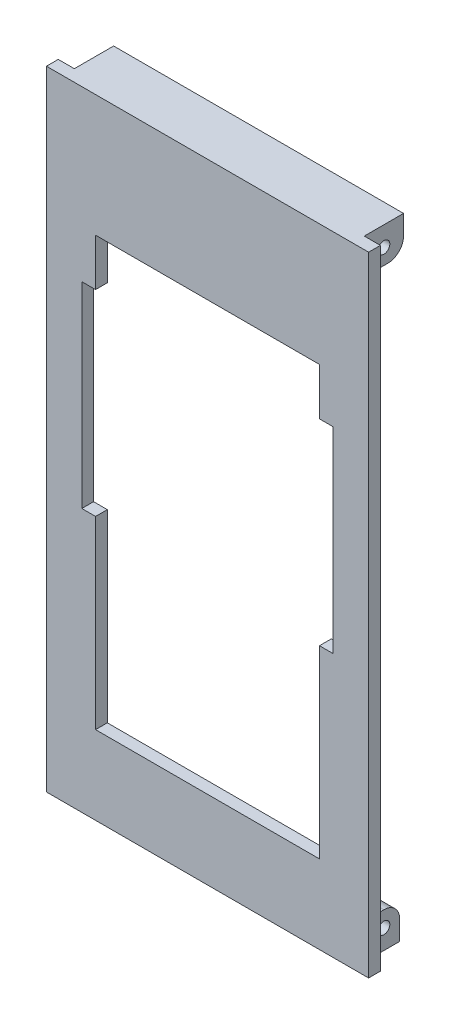
from build123d import *

# Parameters (mm, degrees)
SKETCH3_R           = 1.5
BOSS_EXTRUDE3_DEPTH = 82
CUT_EXTRUDE1_DEPTH  = 181.258148221
SKETCH5_W           = 4.1
SKETCH5_H           = 12
CUT_EXTRUDE2_DEPTH  = 181.258148221
FILLET1_R           = 4


with BuildPart() as part:
    # Sketch3 → Boss-Extrude3 (new body)
    with BuildSketch(Plane(origin=(0, 0, 0), x_dir=(0, 0, -1), z_dir=(1, 0, 0))):
        Polygon((0, 160), (13, 160), (13, 151), (3, 151), (3, 9), (12, 9), (12, 0), (0, 0), align=None)
        with Locations((8, 155)):
            Circle(SKETCH3_R, mode=Mode.SUBTRACT)
        with Locations((8, 5)):
            Circle(SKETCH3_R, mode=Mode.SUBTRACT)
    extrude(amount=BOSS_EXTRUDE3_DEPTH)

    # Sketch4 → Cut-Extrude1 (cut, through all)
    with BuildSketch(Plane.XY):
        Polygon((12.5, 117), (12.5, 129), (69.5, 129), (69.5, 117), (73, 117), (73, 67), (69.5, 67), (69.5, 20), (12.5, 20), (12.5, 67), (9, 67), (9, 117), align=None)
    extrude(amount=-CUT_EXTRUDE1_DEPTH, mode=Mode.SUBTRACT)

    # Sketch5 → Cut-Extrude2 (cut, through all)
    with BuildSketch(Plane(origin=(0, 0, 0), x_dir=(1, 0, 0), z_dir=(0, 1, 0))):
        with Locations((79.95, 9)):
            Rectangle(SKETCH5_W, SKETCH5_H)
        with Locations((2.05, 9)):
            Rectangle(SKETCH5_W, SKETCH5_H)
    extrude(amount=CUT_EXTRUDE2_DEPTH, mode=Mode.SUBTRACT)

    # Fillet1
    fillet1_edges = [part.edges().sort_by_distance(p)[0] for p in [
        (41, 151, -13),
        (41, 9, -12),
    ]]
    fillet(fillet1_edges, radius=FILLET1_R)


solid = part.part
